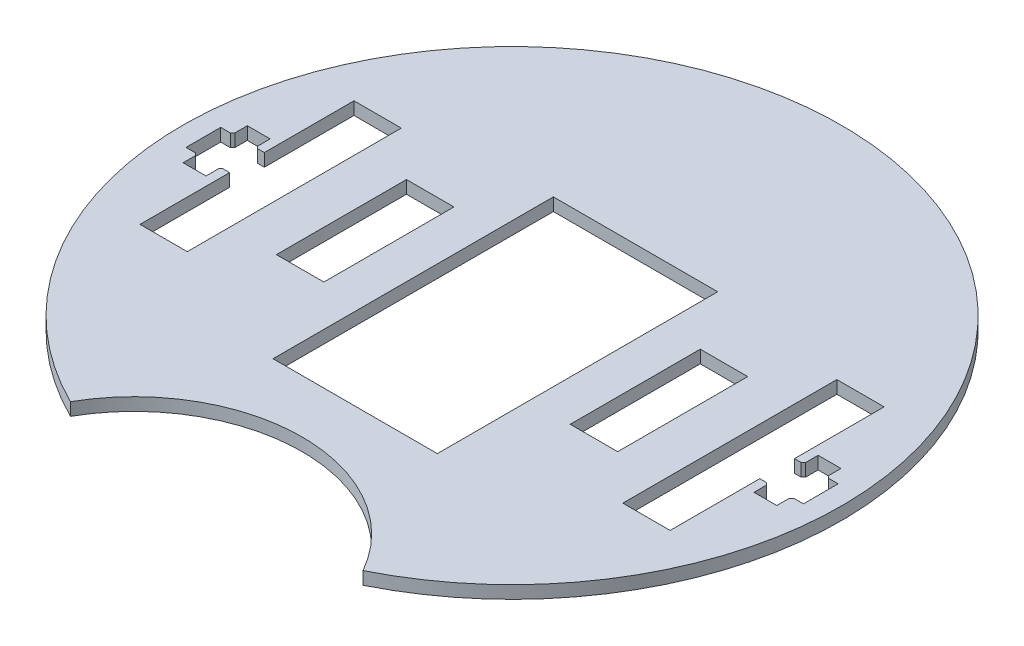
from build123d import *

# Parameters (mm, degrees)
BOSS_EXTRUDE1_DEPTH  = 2.9
SOLENOID_PLACEMENT_W = 37.4
SOLENOID_PLACEMENT_H = 63.8
CUT_EXTRUDE1_DEPTH   = 107.105654892
SKETCH2_W            = 10.76
SKETCH2_H            = 48.705567506
CUT_EXTRUDE2_DEPTH   = 107.105654892
SKETCH3_W            = 10.8
SKETCH3_H            = 29.6
CUT_EXTRUDE3_DEPTH   = 107.105654892
CUT_EXTRUDE4_DEPTH   = 107.105654892
CHAMFER1_SIZE        = 0.5


with BuildPart() as part:
    # Sketch1 → Boss-Extrude1 (new body)
    with BuildSketch(Plane(origin=(0, 0, 0), x_dir=(1, 0, 0), z_dir=(0, 1, 0))):
        with BuildLine():
            ThreePointArc((33.29110537, -67.206415641), (0, 75), (-33.29110537, -67.206415641))
            ThreePointArc((-33.29110537, -67.206415641), (0, -47.791616815), (33.29110537, -67.206415641))
        make_face()
    extrude(amount=BOSS_EXTRUDE1_DEPTH)

    # solenoid placement → Cut-Extrude1 (cut, through all)
    with BuildSketch(Plane(origin=(0, 2.9, 0), x_dir=(1, 0, 0), z_dir=(0, 1, 0))):
        with Locations((0, -3.8)):
            Rectangle(SOLENOID_PLACEMENT_W, SOLENOID_PLACEMENT_H)
    extrude(amount=-CUT_EXTRUDE1_DEPTH, mode=Mode.SUBTRACT)

    # Sketch2 → Cut-Extrude2 (cut, through all)
    with BuildSketch(Plane(origin=(0, 2.9, 0), x_dir=(1, 0, 0), z_dir=(0, 1, 0))):
        with Locations((54.942668207, 0)):
            Rectangle(SKETCH2_W, SKETCH2_H)
        with Locations((-54.942668207, 0)):
            Rectangle(SKETCH2_W, SKETCH2_H)
    extrude(amount=-CUT_EXTRUDE2_DEPTH, mode=Mode.SUBTRACT)

    # Sketch3 → Cut-Extrude3 (cut, through all)
    with BuildSketch(Plane(origin=(0, 2.9, 0), x_dir=(1, 0, 0), z_dir=(0, 1, 0))):
        with Locations((-33.432668207, 0)):
            Rectangle(SKETCH3_W, SKETCH3_H)
        with Locations((33.432668207, 0)):
            Rectangle(SKETCH3_W, SKETCH3_H)
    extrude(amount=-CUT_EXTRUDE3_DEPTH, mode=Mode.SUBTRACT)

    # Sketch4 → Cut-Extrude4 (cut, through all)
    with BuildSketch(Plane(origin=(0, 2.9, 0), x_dir=(1, 0, 0), z_dir=(0, 1, 0))):
        Polygon((-62.352668207, 3.95), (-62.352668207, 7.3), (-67.552668207, 7.3), (-67.552668207, 3.95), (-70.252668207, 3.95), (-70.252668207, -3.95), (-67.552668207, -3.95), (-67.552668207, -7.3), (-62.352668207, -7.3), (-62.352668207, -3.95), (-59.652668207, -3.95), (-59.652668207, 3.95), align=None)
        Polygon((67.552668207, 3.95), (67.552668207, 7.3), (62.352668207, 7.3), (62.352668207, 3.95), (59.652668207, 3.95), (59.652668207, -3.95), (62.352668207, -3.95), (62.352668207, -7.3), (67.552668207, -7.3), (67.552668207, -3.95), (70.252668207, -3.95), (70.252668207, 3.95), align=None)
    extrude(amount=-CUT_EXTRUDE4_DEPTH, mode=Mode.SUBTRACT)

    # Chamfer1
    chamfer1_edges = [part.edges().sort_by_distance(p)[0] for p in [
        (67.552668207, 1.45, 3.95),
        (67.552668207, 1.45, -3.95),
        (62.352668207, 1.45, 3.95),
        (62.352668207, 1.45, -3.95),
        (-67.552668207, 1.45, 3.95),
        (-62.352668207, 1.45, 3.95),
        (-62.352668207, 1.45, -3.95),
        (-67.552668207, 1.45, -3.95),
    ]]
    chamfer(chamfer1_edges, length=CHAMFER1_SIZE)


solid = part.part
